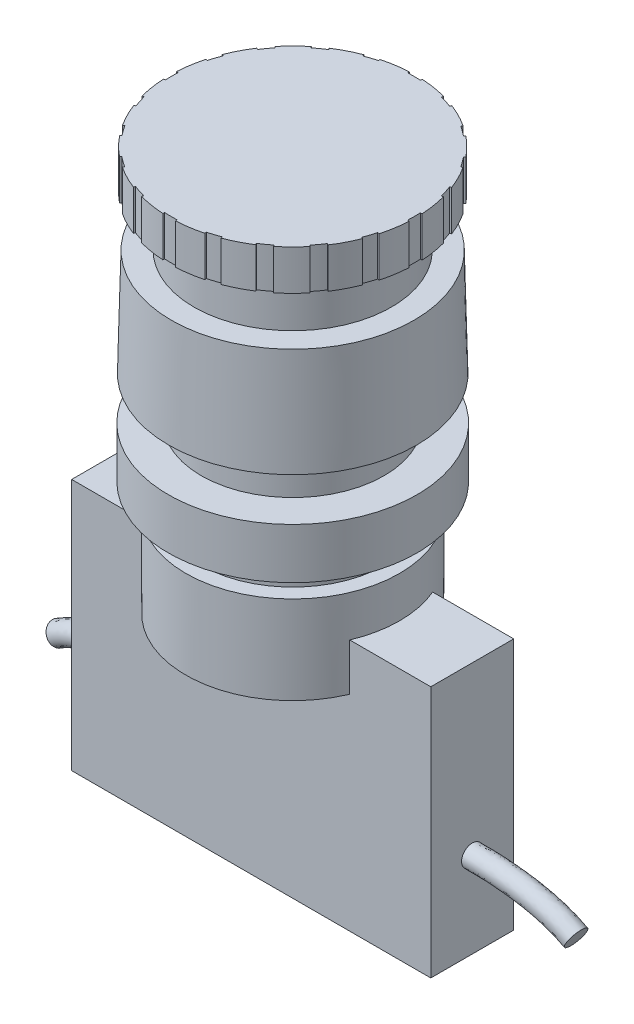
from build123d import *

# Parameters (mm, degrees)
ENROULEMENT1_START      = 42.6
ENROULEMENT1_DEPTH      = 4.7
BOSS_EXTRU_1_DEPTH      = 24
BOSS_EXTRU_1_DEPTH_BACK = 5.5
ESQUISSE3_W             = 42
ESQUISSE3_H             = 9.7
ESQUISSE4_R             = 1.25
ESQUISSE6_R             = 1.25


# Read off the part's stored shape, not the designer's step: Enroulement1
with BuildPart() as part:
    # Esquisse1 → Révolution1 (revolve)
    with BuildSketch(Plane.XY, mode=Mode.PRIVATE) as r_volution1_sk:
        Polygon((0, 47.3), (14.4, 47.3), (14.4, 42.6), (11.55, 42.6), (11.55, 36.8), (14.2, 36.8), (14.5, 24.3), (10.7, 24.3), (10.7, 19.3), (14.55, 19.3), (14.55, 13.4), (10.8, 13.4), (10.8, 10.3), (12.5, 10.3), (12.5, 0), (0, 0), align=None)
    revolve(r_volution1_sk.sketch.rotate(Axis((0, 0, 0), (0, 1, 0)), 90), axis=Axis((0, 0, 0), (0, 1, 0)))

    # Enroulement1 outline → Enroulement1 (cut)
    with BuildSketch(Plane(origin=(0, 0, 0), x_dir=(1, 0, 0), z_dir=(0, 1, 0)).offset(ENROULEMENT1_START)):
        with BuildLine():
            ThreePointArc((14.380473165, -0.749660962), (14.4, 0), (14.380473165, 0.749660962))
            Line((14.380473165, 0.749660962), (14.180744371, 0.739249004))
            ThreePointArc((14.180744371, 0.739249004), (14.2, 0), (14.180744371, -0.739249004))
            Line((14.180744371, -0.739249004), (14.380473165, -0.749660962))
        make_face()
        with BuildLine():
            Line((13.716124065, 3.675315038), (13.909308911, 3.727080039))
            ThreePointArc((13.909308911, 3.727080039), (13.696416467, 4.446141693), (13.446378514, 5.153145142))
            Line((13.446378514, 5.153145142), (13.259623257, 5.081573682))
            ThreePointArc((13.259623257, 5.081573682), (13.506188461, 4.384389725), (13.716124065, 3.675315038))
        make_face()
        with BuildLine():
            ThreePointArc((13.418316271, -5.225781132), (13.672173692, -4.520140101), (13.888951351, -3.802240177))
            Line((13.888951351, -3.802240177), (13.696049249, -3.749431285))
            ThreePointArc((13.696049249, -3.749431285), (13.482282391, -4.457360377), (13.231950768, -5.153200839))
            Line((13.231950768, -5.153200839), (13.418316271, -5.225781132))
        make_face()
        with BuildLine():
            Line((11.911165006, 7.730727533), (12.078927894, 7.83961102))
            ThreePointArc((12.078927894, 7.83961102), (11.654420007, 8.457806708), (11.198304628, 9.053064313))
            Line((11.198304628, 9.053064313), (11.042772619, 8.927327309))
            ThreePointArc((11.042772619, 8.927327309), (11.492553062, 8.34033717), (11.911165006, 7.730727533))
        make_face()
        with BuildLine():
            ThreePointArc((11.149186429, -9.113486818), (11.608513996, -8.520704361), (12.036358571, -7.904813239))
            Line((12.036358571, -7.904813239), (11.869186924, -7.795024166))
            ThreePointArc((11.869186924, -7.795024166), (11.447284635, -8.402361245), (10.994336617, -8.986910612))
            Line((10.994336617, -8.986910612), (11.149186429, -9.113486818))
        make_face()
        with BuildLine():
            Line((8.942247676, 11.030693836), (9.068194826, 11.186055721))
            ThreePointArc((9.068194826, 11.186055721), (8.473554379, 11.642975401), (7.855933141, 12.068318627))
            Line((7.855933141, 12.068318627), (7.746822958, 11.900703091))
            ThreePointArc((7.746822958, 11.900703091), (8.355866124, 11.481267409), (8.942247676, 11.030693836))
        make_face()
        with BuildLine():
            ThreePointArc((7.790558812, -12.110623163), (8.410471065, -11.688625944), (9.007573613, -11.234928465))
            Line((9.007573613, -11.234928465), (8.882468424, -11.078887792))
            ThreePointArc((8.882468424, -11.078887792), (8.293658967, -11.526283917), (7.682356606, -11.942420064))
            Line((7.682356606, -11.942420064), (7.790558812, -12.110623163))
        make_face()
        with BuildLine():
            Line((5.099494483, 13.252741453), (5.171318349, 13.439399783))
            ThreePointArc((5.171318349, 13.439399783), (4.464653568, 13.690393293), (3.745880376, 13.904257629))
            Line((3.745880376, 13.904257629), (3.69385426, 13.711142939))
            ThreePointArc((3.69385426, 13.711142939), (4.402644491, 13.500248942), (5.099494483, 13.252741453))
        make_face()
        with BuildLine():
            ThreePointArc((3.670638294, -13.924310199), (4.390557449, -13.714335758), (5.098569146, -13.46716721))
            Line((5.098569146, -13.46716721), (5.027755685, -13.280123221))
            ThreePointArc((5.027755685, -13.280123221), (4.329577484, -13.523858873), (3.619657206, -13.730917002))
            Line((3.619657206, -13.730917002), (3.670638294, -13.924310199))
        make_face()
        with BuildLine():
            Line((0.758419021, 14.179732035), (0.769100979, 14.379446571))
            ThreePointArc((0.769100979, 14.379446571), (0.0194671, 14.399986841), (-0.730219575, 14.381473477))
            Line((-0.730219575, 14.381473477), (-0.720077636, 14.18173079))
            ThreePointArc((-0.720077636, 14.18173079), (0.019196724, 14.199987024), (0.758419021, 14.179732035))
        make_face()
        with BuildLine():
            ThreePointArc((-0.80797676, -14.377314546), (-0.058401157, -14.399881573), (0.691332833, -14.38339525))
            Line((0.691332833, -14.38339525), (0.681730988, -14.183625871))
            ThreePointArc((0.681730988, -14.183625871), (-0.05759003, -14.199883217), (-0.796754861, -14.177629622))
            Line((-0.796754861, -14.177629622), (-0.80797676, -14.377314546))
        make_face()
        with BuildLine():
            Line((-3.656769099, 13.721080123), (-3.70827289, 13.914334773))
            ThreePointArc((-3.70827289, 13.914334773), (-4.427621692, 13.70241461), (-5.134962517, 13.453332671))
            Line((-5.134962517, 13.453332671), (-5.063643593, 13.266480828))
            ThreePointArc((-5.063643593, 13.266480828), (-4.366126946, 13.512103296), (-3.656769099, 13.721080123))
        make_face()
        with BuildLine():
            ThreePointArc((-5.207636378, -13.425368649), (-4.501652806, -13.678271894), (-3.78346048, -13.894078839))
            Line((-3.78346048, -13.894078839), (-3.730912418, -13.701105522))
            ThreePointArc((-3.730912418, -13.701105522), (-4.439129851, -13.488295896), (-5.135308095, -13.238905195))
            Line((-5.135308095, -13.238905195), (-5.207636378, -13.425368649))
        make_face()
        with BuildLine():
            Line((-7.71461798, 11.921605153), (-7.823274572, 12.089515084))
            ThreePointArc((-7.823274572, 12.089515084), (-8.44204358, 11.665843313), (-9.037917255, 11.210533069))
            Line((-9.037917255, 11.210533069), (-8.912390626, 11.054831221))
            ThreePointArc((-8.912390626, 11.054831221), (-8.324792974, 11.503817711), (-7.71461798, 11.921605153))
        make_face()
        with BuildLine():
            ThreePointArc((-9.098406106, -11.161496599), (-8.505003234, -11.620022374), (-7.88853428, -12.047033947))
            Line((-7.88853428, -12.047033947), (-7.778971304, -11.879714031))
            ThreePointArc((-7.778971304, -11.879714031), (-8.38687819, -11.458633175), (-8.972039355, -11.006475813))
            Line((-8.972039355, -11.006475813), (-9.098406106, -11.161496599))
        make_face()
        with BuildLine():
            Line((-11.018594893, 8.9571517), (-11.173786371, 9.083308766))
            ThreePointArc((-11.173786371, 9.083308766), (-11.631509516, 8.489286564), (-12.057687305, 7.872240904))
            Line((-12.057687305, 7.872240904), (-11.890219426, 7.762904225))
            ThreePointArc((-11.890219426, 7.762904225), (-11.469960773, 8.371379806), (-11.018594893, 8.9571517))
        make_face()
        with BuildLine():
            ThreePointArc((-12.100080181, -7.806923826), (-11.677245299, -8.426265022), (-11.222741022, -9.022753679))
            Line((-11.222741022, -9.022753679), (-11.066869619, -8.897437655))
            ThreePointArc((-11.066869619, -8.897437655), (-11.515061337, -8.309233564), (-11.932023512, -7.698494328))
            Line((-11.932023512, -7.698494328), (-12.100080181, -7.806923826))
        make_face()
        with BuildLine():
            Line((-13.245835428, 5.117405965), (-13.432396491, 5.189482105))
            ThreePointArc((-13.432396491, 5.189482105), (-13.684345098, 4.483157283), (-13.899180935, 3.764673868))
            Line((-13.899180935, 3.764673868), (-13.706136755, 3.712386731))
            ThreePointArc((-13.706136755, 3.712386731), (-13.49428475, 4.42089121), (-13.245835428, 5.117405965))
        make_face()
        with BuildLine():
            ThreePointArc((-13.919335205, -3.689458963), (-13.708387711, -4.409093599), (-13.46026224, -5.116770507))
            Line((-13.46026224, -5.116770507), (-13.273314154, -5.04570425))
            ThreePointArc((-13.273314154, -5.04570425), (-13.517993437, -4.347856188), (-13.726011105, -3.638216477))
            Line((-13.726011105, -3.638216477), (-13.919335205, -3.689458963))
        make_face()
        with BuildLine():
            Line((-14.178693785, 0.777587651), (-14.378393697, 0.78853959))
            ThreePointArc((-14.378393697, 0.78853959), (-14.399947366, 0.038934164), (-14.382447506, -0.710776853))
            Line((-14.382447506, -0.710776853), (-14.182691291, -0.700904953))
            ThreePointArc((-14.182691291, -0.700904953), (-14.199948097, 0.038393412), (-14.178693785, 0.777587651))
        make_face()
    extrude(amount=ENROULEMENT1_DEPTH, mode=Mode.SUBTRACT)

    # Esquisse3 → Boss.-Extru.1 (add, two sides: drawn at the far end of the back side and taken through both)
    with BuildSketch(Plane.XZ.offset(-BOSS_EXTRU_1_DEPTH_BACK)):
        Rectangle(ESQUISSE3_W, ESQUISSE3_H)
    extrude(amount=BOSS_EXTRU_1_DEPTH + BOSS_EXTRU_1_DEPTH_BACK)

    # Balayage1: sweep along a path in Esquisse5
    with BuildLine() as balayage1_path:  # in the path sketch's own coordinates; laid on its plane below (add() does not lay a ready-made edge on the line's plane)
        add(Edge.make_bspline(
            [(-21, -14), (-23.280628382, -14), (-25.499476733, -14.452449087), (-27.420277746, -15.716478279)],
            knots=[0, 0, 0, 0, 1, 1, 1, 1], degree=3))
    # Esquisse4 → Balayage1 (sweep)
    with BuildSketch(Plane.ZY.offset(21)):
        with Locations((0, -14)):
            Circle(ESQUISSE4_R)
    sweep(path=Plane.XY.offset(4.85) * balayage1_path.line)

    # Balayage2: sweep along a path in Esquisse7
    with BuildLine() as balayage2_path:  # in the path sketch's own coordinates; laid on its plane below (add() does not lay a ready-made edge on the line's plane)
        add(Edge.make_bspline(
            [(21, -14), (24.86572822, -14), (29.597130878, -14.343825216), (33.145672669, -16.278624646)],
            knots=[0, 0, 0, 0, 1, 1, 1, 1], degree=3))
    # Esquisse6 → Balayage2 (sweep)
    with BuildSketch(Plane(origin=(21, 0, 0), x_dir=(0, 0, -1), z_dir=(1, 0, 0))):
        with Locations((0, -14)):
            Circle(ESQUISSE6_R)
    sweep(path=Plane.XY.offset(4.85) * balayage2_path.line)


solid = part.part
